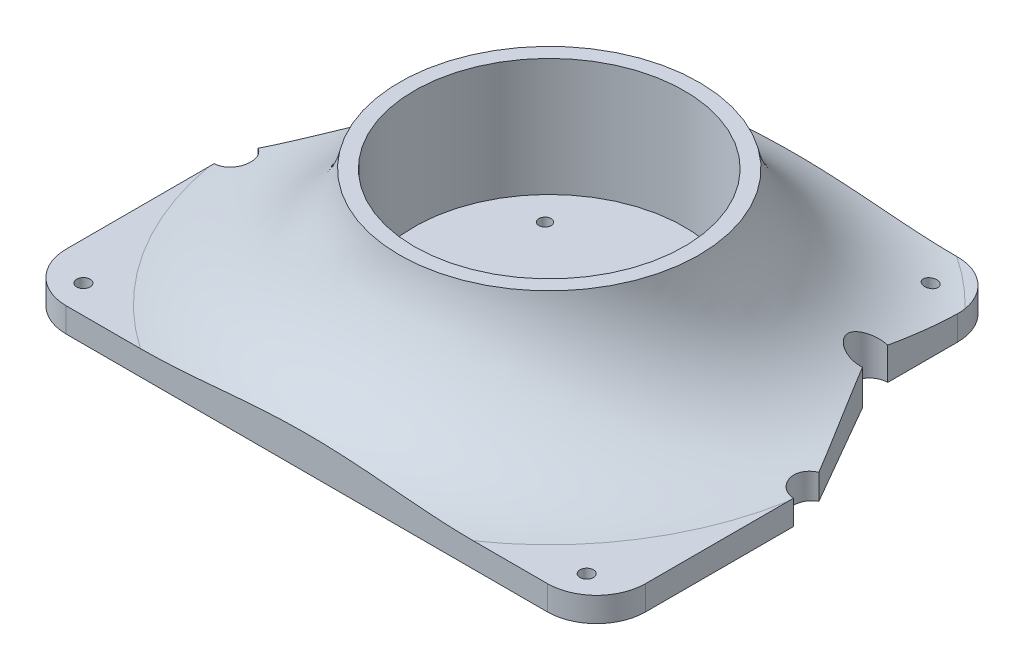
from build123d import *

# Parameters (mm, degrees)
BOSS_EXTRUDE1_DEPTH = 5
FILLET1_R           = 10
SKETCH2_R           = 1.375
SKETCH2_R_2         = 3.75
CUT_EXTRUDE1_DEPTH  = 116.680049132
SKETCH3_R           = 1.25
SKETCH3_W           = 14
SKETCH3_H           = 20
CUT_EXTRUDE2_DEPTH  = 5
SKETCH5_R           = 30.5
SKETCH5_R_2         = 27.5
BOSS_EXTRUDE2_DEPTH = 24
FILLET2_START       = 5
FILLET2_2_OUTLINE_R = 1.375
FILLET2_2_DEPTH     = 4.125417965
FILLET3_R           = 10


with BuildPart() as part:
    # Sketch1 → Boss-Extrude1 (new body)
    with BuildSketch(Plane(origin=(0, 0, 0), x_dir=(1, 0, 0), z_dir=(0, 1, 0))):
        Polygon((-43.18, 0), (43.18, 0), (43.18, -28), (59, -55.467430874), (59, -99.377430874), (-59, -99.377430874), (-59, -55.467430874), (-43.18, -28), align=None)
    extrude(amount=BOSS_EXTRUDE1_DEPTH)

    # Fillet1
    fillet1_edges = [part.edges().sort_by_distance(p)[0] for p in [
        (-43.18, 2.5, 0),
        (43.18, 2.5, 0),
    ]]
    fillet(fillet1_edges, radius=FILLET1_R)

    # Sketch2 → Cut-Extrude1 (cut, through all)
    with BuildSketch(Plane(origin=(0, 5, 0), x_dir=(1, 0, 0), z_dir=(0, 1, 0))):
        with Locations(Location((-51.25, -93.627430874, 0), (0, 0, 270))):
            Circle(SKETCH2_R)
        with Locations(Location((-35.43, -7.75, 0), (0, 0, 270))):
            Circle(SKETCH2_R)
        with Locations(Location((35.43, -7.75, 0), (0, 0, 270))):
            Circle(SKETCH2_R)
        with Locations(Location((51.25, -93.627430874, 0), (0, 0, 270))):
            Circle(SKETCH2_R)
        with Locations((-59, -55.467430874)):
            Circle(SKETCH2_R_2)
        with Locations((-43.18, -28)):
            Circle(SKETCH2_R_2)
        with Locations((43.18, -28)):
            Circle(SKETCH2_R_2)
        with Locations((59, -55.467430874)):
            Circle(SKETCH2_R_2)
    extrude(amount=-CUT_EXTRUDE1_DEPTH, mode=Mode.SUBTRACT)

    # Sketch3 → Cut-Extrude2 (cut)
    with BuildSketch(Plane(origin=(0, 5, 0), x_dir=(1, 0, 0), z_dir=(0, 1, 0))):
        with Locations(Location((-15, -35.859343003, 0), (0, 0, 270))):
            Circle(SKETCH3_R)
        with Locations(Location((15, -35.859343003, 0), (0, 0, 270))):
            Circle(SKETCH3_R)
        with Locations(Location((15, -65.859343003, 0), (0, 0, 270))):
            Circle(SKETCH3_R)
        with Locations(Location((-15, -65.859343003, 0), (0, 0, 270))):
            Circle(SKETCH3_R)
        with Locations((0, -65)):
            Rectangle(SKETCH3_W, SKETCH3_H)
    extrude(amount=-CUT_EXTRUDE2_DEPTH, mode=Mode.SUBTRACT)

    # Sketch5 → Boss-Extrude2 (add)
    with BuildSketch(Plane(origin=(0, 5, 0), x_dir=(1, 0, 0), z_dir=(0, 1, 0))):
        with Locations(Location((0, -50, 0), (0, 0, 90))):
            Circle(SKETCH5_R)
        with Locations(Location((0, -50, 0), (0, 0, 270))):
            Circle(SKETCH5_R_2, mode=Mode.SUBTRACT)
    extrude(amount=BOSS_EXTRUDE2_DEPTH)

    # Fillet2: read off the stored shape, not the designer's step
    # Fillet2 outline → Fillet2 (revolve)
    with BuildSketch(Plane.XY.offset(50)):
        with BuildLine():
            Line((30.5, 5), (59.893876913, 5))
            ThreePointArc((59.893876913, 5), (40.920210952, 11.762099923), (30.5, 29))
            Line((30.5, 29), (30.5, 5))
        make_face()
    revolve(axis=Axis((0, 0, 50), (0, 1, 0)))

    # Fillet2 2 outline → Fillet2 2 (cut)
    with BuildSketch(Plane(origin=(0, 0, 0), x_dir=(1, 0, 0), z_dir=(0, 1, 0)).offset(FILLET2_START)):
        with Locations((35.43, -7.75)):
            Circle(FILLET2_2_OUTLINE_R)
        with Locations((-35.43, -7.75)):
            Circle(FILLET2_2_OUTLINE_R)
        with BuildLine():
            Line((33.899053261, -99.377430874), (-33.899053261, -99.377430874))
            ThreePointArc((-33.899053261, -99.377430874), (0, -109.893876913), (33.899053261, -99.377430874))
        make_face()
        with BuildLine():
            ThreePointArc((-43.043276128, -8.352036402), (-57.254609777, -32.416310088), (-59, -60.309049019))
            Line((-59, -60.309049019), (-59, -59.217430874))
            ThreePointArc((-59, -59.217430874), (-55.377270458, -56.436105569), (-57.128401901, -52.217873895))
            Line((-57.128401901, -52.217873895), (-45.051598099, -31.249556979))
            ThreePointArc((-45.051598099, -31.249556979), (-39.557270458, -28.968674695), (-43.18, -24.25))
            Line((-43.18, -24.25), (-43.18, -10))
            ThreePointArc((-43.18, -10), (-43.145760415, -9.173187229), (-43.043276128, -8.352036402))
        make_face()
        with BuildLine():
            ThreePointArc((32.973875897, 0), (0, 9.893876913), (-32.973875897, 0))
            Line((-32.973875897, 0), (32.973875897, 0))
        make_face()
        with BuildLine():
            ThreePointArc((59, -60.309049019), (57.254609777, -32.416310088), (43.043276128, -8.352036402))
            ThreePointArc((43.043276128, -8.352036402), (43.145760415, -9.173187229), (43.18, -10))
            Line((43.18, -10), (43.18, -24.25))
            ThreePointArc((43.18, -24.25), (39.557270458, -28.968674695), (45.051598099, -31.249556979))
            Line((45.051598099, -31.249556979), (57.128401901, -52.217873895))
            ThreePointArc((57.128401901, -52.217873895), (55.377270458, -56.436105569), (59, -59.217430874))
            Line((59, -59.217430874), (59, -60.309049019))
        make_face()
    extrude(amount=FILLET2_2_DEPTH, mode=Mode.SUBTRACT)

    # Fillet3
    fillet3_edges = [part.edges().sort_by_distance(p)[0] for p in [
        (59, 2.5, 99.377430874),
        (-59, 2.5, 99.377430874),
    ]]
    fillet(fillet3_edges, radius=FILLET3_R)


solid = part.part
